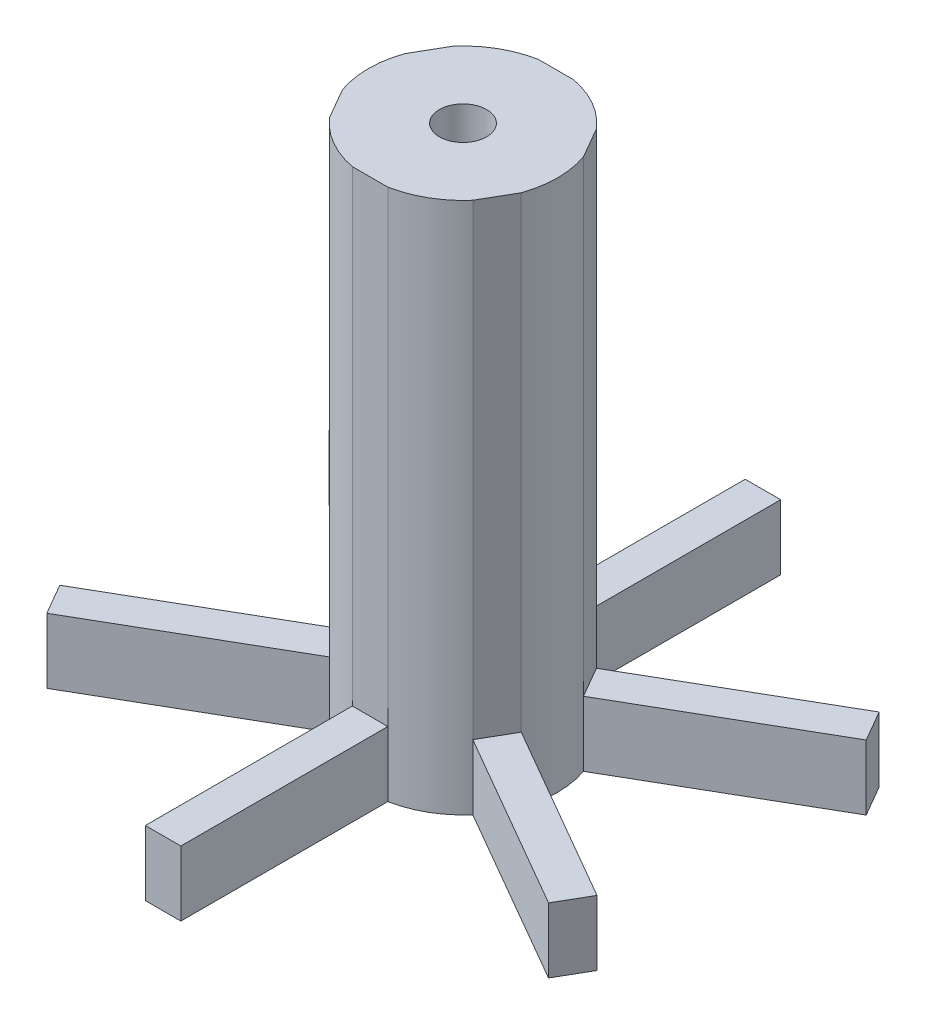
from build123d import *

# Parameters (mm, degrees)
SKETCH1_R           = 2
BOSS_EXTRUDE1_DEPTH = 45
SKETCH1_3_W         = 3
SKETCH1_3_H         = 17.5
BOSS_EXTRUDE2_DEPTH = 5.5


with BuildPart() as part:
    # Sketch1 → Boss-Extrude1 (new body)
    with BuildSketch(Plane(origin=(0, 0, 0), x_dir=(1, 0, 0), z_dir=(0, 1, 0))):
        with BuildLine():
            ThreePointArc((-6.055328794, -5.228096517), (-4, -6.92820323), (-1.5, -7.858116823))
            Line((-1.5, -7.858116823), (1.5, -7.858116823))
            ThreePointArc((1.5, -7.858116823), (4, -6.92820323), (6.055328794, -5.228096517))
            Line((6.055328794, -5.228096517), (7.555328794, -2.630020306))
            ThreePointArc((7.555328794, -2.630020306), (8, 0), (7.555328794, 2.630020306))
            Line((7.555328794, 2.630020306), (6.055328794, 5.228096517))
            ThreePointArc((6.055328794, 5.228096517), (4, 6.92820323), (1.5, 7.858116823))
            Line((1.5, 7.858116823), (-1.5, 7.858116823))
            ThreePointArc((-1.5, 7.858116823), (-4, 6.92820323), (-6.055328794, 5.228096517))
            Line((-6.055328794, 5.228096517), (-7.555328794, 2.630020306))
            ThreePointArc((-7.555328794, 2.630020306), (-8, 0), (-7.555328794, -2.630020306))
            Line((-7.555328794, -2.630020306), (-6.055328794, -5.228096517))
        make_face()
        Circle(SKETCH1_R, mode=Mode.SUBTRACT)
    extrude(amount=BOSS_EXTRUDE1_DEPTH)

    # Sketch1<3> → Boss-Extrude2 (add)
    with BuildSketch(Plane(origin=(0, 0, 0), x_dir=(1, 0, 0), z_dir=(0, 1, 0))):
        with Locations((0, -16.608116823)):
            Rectangle(SKETCH1_3_W, SKETCH1_3_H)
        Polygon((-21.210773361, -13.978096517), (-6.055328794, -5.228096517), (-7.555328794, -2.630020306), (-22.710773361, -11.380020306), align=None)
        Polygon((7.555328794, -2.630020306), (6.055328794, -5.228096517), (21.210773361, -13.978096517), (22.710773361, -11.380020306), align=None)
        Polygon((-22.710773361, 11.380020306), (-7.555328794, 2.630020306), (-6.055328794, 5.228096517), (-21.210773361, 13.978096517), align=None)
        Polygon((6.055328794, 5.228096517), (7.555328794, 2.630020306), (22.710773361, 11.380020306), (21.210773361, 13.978096517), align=None)
        with Locations((0, 16.608116823)):
            Rectangle(SKETCH1_3_W, SKETCH1_3_H)
    extrude(amount=BOSS_EXTRUDE2_DEPTH)


solid = part.part
